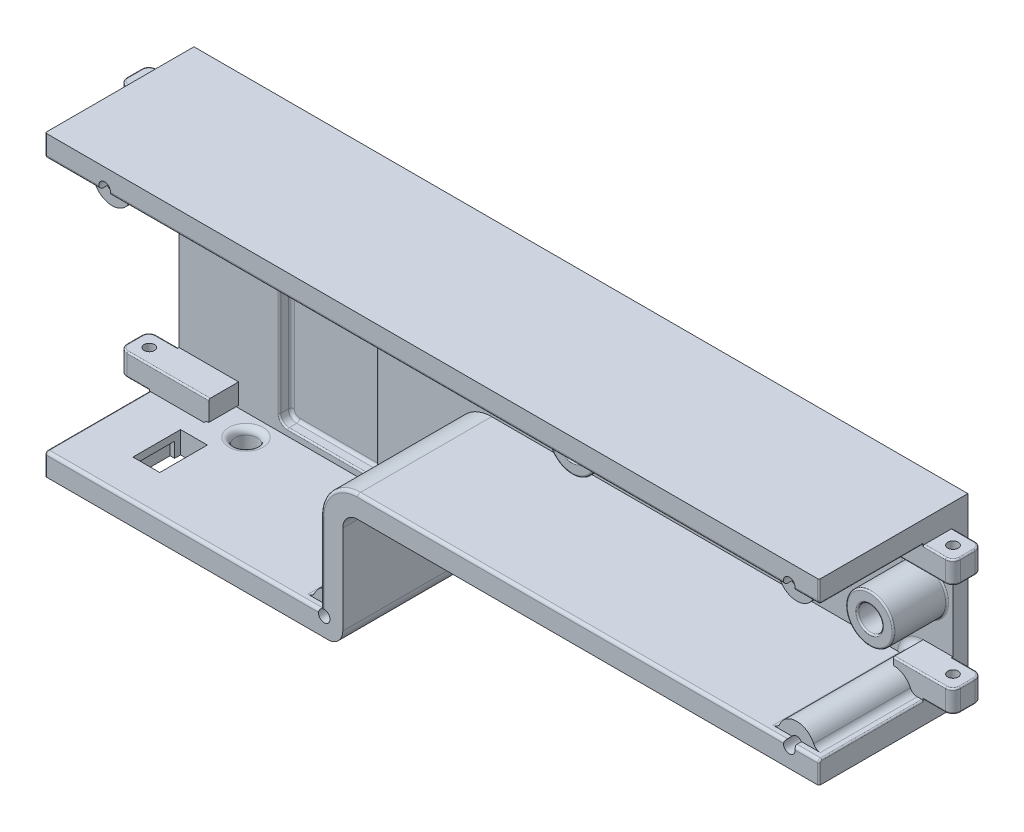
from build123d import *

# Parameters (mm, degrees)
SKETCH1_W             = 840
SKETCH1_H             = 140
SKETCH1_R             = 4.15
BOSS_EXTRUDE1_DEPTH   = 5
SKETCH2_R             = 8
SKETCH2_R_2           = 4.15
BOSS_EXTRUDE3_DEPTH   = 18
LPATTERN1_COUNT       = 7
LPATTERN1_PITCH       = 100
SKETCH4_W             = 45.610881299
SKETCH4_H             = 87.937650726
BOSS_EXTRUDE4_DEPTH   = 1
SKETCH5_W             = 840
SKETCH5_H             = 5
CUT_EXTRUDE1_DEPTH    = 40
SKETCH6_W             = 720
SKETCH6_H             = 40
CUT_EXTRUDE2_DEPTH    = 427.173673518
FILLET1_R             = 5
FILLET2_R             = 0.5
FILLET3_R             = 1
BOSS_EXTRUDE5_DEPTH   = 45
FILLET4_R             = 1
SKETCH10_W            = 7.375
SKETCH10_H            = 85.25
CUT_EXTRUDE3_DEPTH    = 45
FILLET5_R             = 1
SKETCH11_R            = 4.15
BOSS_EXTRUDE6_DEPTH   = 5
CUT_EXTRUDE4_DEPTH    = 20
SKETCH13_W            = 12
SKETCH13_H            = 12
CUT_EXTRUDE5_DEPTH    = 5
CUT_EXTRUDE6_REACH    = 1266.951
SKETCH14_W            = 9
SKETCH14_H            = 16
SKETCH20_R            = 1.95
CUT_EXTRUDE8_DEPTH    = 26
BOSS_EXTRUDE8_REACH   = 1264.837
SKETCH22_R            = 6.25
SKETCH22_R_2          = 1.95
BOSS_EXTRUDE9_DEPTH   = 19
FILLET6_R             = 2.5
SKETCH24_W            = 124.039540835
SKETCH24_H            = 143.716496108
CUT_EXTRUDE9_DEPTH    = 567.568618977
BOSS_EXTRUDE10_DEPTH  = 10
SKETCH26_W            = 9.875
SKETCH26_H            = 7.5
BOSS_EXTRUDE11_DEPTH  = 10
FILLET7_R             = 2.5
FILLET8_R             = 0.5
FILLET7_OF_MIRROR2_R  = 2.5
FILLET8_OF_MIRROR2_R  = 0.5
SKETCH27_R            = 1.75
CUT_EXTRUDE10_DEPTH   = 55
FILLET9_R             = 0.5
CUT_EXTRUDE11_REACH   = 720.749
SKETCH28_R            = 3.75
FILLET10_R            = 2
BOSS_EXTRUDE12_DEPTH  = 10
SKETCH30_W            = 9.875
SKETCH30_H            = 7.5
BOSS_EXTRUDE13_DEPTH  = 10
FILLET11_R            = 2.5
FILLET12_R            = 0.5
FILLET11_OF_MIRROR3_R = 2.5
FILLET12_OF_MIRROR3_R = 0.5
SKETCH31_R            = 1.75
CUT_EXTRUDE12_DEPTH   = 718.743861104


with BuildPart() as part:
    # Sketch1 → Boss-Extrude1 (new body)
    with BuildSketch(Plane.XY):
        Rectangle(SKETCH1_W, SKETCH1_H)
        with Locations((-350, 0)):
            Circle(SKETCH1_R, mode=Mode.SUBTRACT)
        with Locations((-250, 0)):
            Circle(SKETCH1_R, mode=Mode.SUBTRACT)
        with Locations((-150, 0)):
            Circle(SKETCH1_R, mode=Mode.SUBTRACT)
        with Locations((-50, 0)):
            Circle(SKETCH1_R, mode=Mode.SUBTRACT)
        with Locations((50, 0)):
            Circle(SKETCH1_R, mode=Mode.SUBTRACT)
        with Locations((150, 0)):
            Circle(SKETCH1_R, mode=Mode.SUBTRACT)
        with Locations((250, 0)):
            Circle(SKETCH1_R, mode=Mode.SUBTRACT)
        with BuildLine():
            Line((333.7, -57.5), (333.7, 17.5))
            ThreePointArc((333.7, 17.5), (334.520101013, 19.479898987), (336.5, 20.3))
            Line((336.5, 20.3), (363.5, 20.3))
            ThreePointArc((363.5, 20.3), (365.479898987, 19.479898987), (366.3, 17.5))
            Line((366.3, 17.5), (366.3, -57.5))
            ThreePointArc((366.3, -57.5), (365.479898987, -59.479898987), (363.5, -60.3))
            Line((363.5, -60.3), (336.5, -60.3))
            ThreePointArc((336.5, -60.3), (334.520101013, -59.479898987), (333.7, -57.5))
        make_face(mode=Mode.SUBTRACT)
    extrude(amount=BOSS_EXTRUDE1_DEPTH)

    # Sketch2 → Boss-Extrude3 (add)
    with BuildSketch(Plane.XY.offset(5)):
        with Locations(Location((-350, 0, 0), (0, 0, 180))):
            Circle(SKETCH2_R)
        with Locations((-350, 0)):
            Circle(SKETCH2_R_2, mode=Mode.SUBTRACT)
    boss_extrude3 = extrude(amount=BOSS_EXTRUDE3_DEPTH)

    # LPattern1: Boss-Extrude3 ×7
    with Locations(*[(i * LPATTERN1_PITCH, 0, 0) for i in range(1, LPATTERN1_COUNT)]):
        add(boss_extrude3)

    # Sketch4 → Boss-Extrude4 (add)
    with BuildSketch(Plane(origin=(0, 0, 0), x_dir=(-1, 0, 0), z_dir=(0, 0, -1))):
        with Locations((-349.932526386, -19.852361379)):
            Rectangle(SKETCH4_W, SKETCH4_H)
    extrude(amount=-BOSS_EXTRUDE4_DEPTH)

    # Sketch5 → Cut-Extrude1 (cut)
    with BuildSketch(Plane(origin=(0, 70, 0), x_dir=(1, 0, 0), z_dir=(0, 1, 0))):
        with Locations((0, -2.5)):
            Rectangle(SKETCH5_W, SKETCH5_H)
    extrude(amount=-CUT_EXTRUDE1_DEPTH, mode=Mode.SUBTRACT)

    # Sketch6 → Cut-Extrude2 (cut, through all)
    with BuildSketch(Plane.XY.offset(5)):
        with Locations((-60, -50)):
            Rectangle(SKETCH6_W, SKETCH6_H)
    extrude(amount=-CUT_EXTRUDE2_DEPTH, mode=Mode.SUBTRACT)

    # Fillet1
    fillet1_edges = [part.edges().sort_by_distance(p)[0] for p in [
        (-420, 30, 2.5),
        (-420, -30, 2.5),
        (300, -30, 2.5),
        (300, -70, 2.5),
    ]]
    fillet(fillet1_edges, radius=FILLET1_R)

    # Fillet2
    fillet2_edges = [part.edges().sort_by_distance(p)[0] for p in [
        (334.520101013, -59.479898987, 5),
        (350, -60.3, 5),
        (365.479898987, -59.479898987, 5),
        (366.3, -20, 5),
        (365.479898987, 19.479898987, 5),
        (350, 20.3, 5),
        (334.520101013, 19.479898987, 5),
        (333.7, -20, 5),
        (-342, 0, 5),
        (-342, 0, 23),
        (-354.15, 0, 23),
        (258, 0, 5),
        (158, 0, 5),
        (58, 0, 5),
        (-42, 0, 5),
        (-142, 0, 5),
        (-242, 0, 5),
        (-242, 0, 23),
        (-254.15, 0, 23),
        (-142, 0, 23),
        (-154.15, 0, 23),
        (-42, 0, 23),
        (-54.15, 0, 23),
        (58, 0, 23),
        (45.85, 0, 23),
        (158, 0, 23),
        (145.85, 0, 23),
        (258, 0, 23),
        (245.85, 0, 23),
    ]]
    fillet(fillet2_edges, radius=FILLET2_R)

    # Fillet3
    fillet3_edges = [part.edges().sort_by_distance(p)[0] for p in [
        (333.7, -20, 1),
        (350, -60.3, 1),
        (334.520101013, -59.479898987, 1),
        (334.520101013, 19.479898987, 1),
        (350, 20.3, 1),
        (365.479898987, 19.479898987, 1),
        (366.3, -20, 1),
        (365.479898987, -59.479898987, 1),
    ]]
    fillet(fillet3_edges, radius=FILLET3_R)

    # Sketch8 → Boss-Extrude5 (add)
    with BuildSketch(Plane.XY.offset(5)):
        with BuildLine():
            Line((300, -35), (300, -65))
            ThreePointArc((300, -65), (301.464466094, -68.535533906), (305, -70))
            Line((305, -70), (420, -70))
            Line((420, -70), (420, 30))
            Line((420, 30), (-415, 30))
            ThreePointArc((-415, 30), (-418.535533906, 28.535533906), (-420, 25))
            Line((-420, 25), (-420, -25))
            ThreePointArc((-420, -25), (-418.535533906, -28.535533906), (-415, -30))
            Line((-415, -30), (295, -30))
            ThreePointArc((295, -30), (298.535533906, -31.464466094), (300, -35))
        make_face()
        with BuildLine():
            Line((412.625, -62.625), (412.625, 22.625))
            Line((412.625, 22.625), (-412.625, 22.625))
            Line((-412.625, 22.625), (-412.625, -22.625))
            Line((-412.625, -22.625), (295, -22.625))
            ThreePointArc((295, -22.625), (303.750446417, -26.249553583), (307.375, -35))
            Line((307.375, -35), (307.375, -62.625))
            Line((307.375, -62.625), (412.625, -62.625))
        make_face(mode=Mode.SUBTRACT)
    extrude(amount=BOSS_EXTRUDE5_DEPTH)

    # Fillet4
    fillet4_edges = [part.edges().sort_by_distance(p)[0] for p in [
        (-58.8125, -22.625, 50),
        (303.750446417, -26.249553583, 50),
        (307.375, -48.8125, 50),
    ]]
    fillet(fillet4_edges, radius=FILLET4_R)

    # Sketch10 → Cut-Extrude3 (cut)
    with BuildSketch(Plane.XY.offset(50)):
        with Locations((416.3125, -20)):
            Rectangle(SKETCH10_W, SKETCH10_H)
    extrude(amount=-CUT_EXTRUDE3_DEPTH, mode=Mode.SUBTRACT)

    # Fillet5
    fillet5_edges = [part.edges().sort_by_distance(p)[0] for p in [
        (-412.625, -0.5, 50),
        (3.6875, 22.625, 50),
        (363.1875, -62.625, 50),
    ]]
    fillet(fillet5_edges, radius=FILLET5_R)

    # Sketch11 → Boss-Extrude6 (add)
    with BuildSketch(Plane(origin=(0, 0, 0), x_dir=(-1, 0, 0), z_dir=(0, 0, -1))):
        with Locations((-250, 0)):
            Circle(SKETCH11_R)
        with Locations((-150, 0)):
            Circle(SKETCH11_R)
        with Locations((-50, 0)):
            Circle(SKETCH11_R)
        with Locations((50, 0)):
            Circle(SKETCH11_R)
        with Locations((150, 0)):
            Circle(SKETCH11_R)
        with Locations((250, 0)):
            Circle(SKETCH11_R)
        with Locations((350, 0)):
            Circle(SKETCH11_R)
    extrude(amount=-BOSS_EXTRUDE6_DEPTH)


with BuildPart() as body_2:
    # Mirror1: mirrored copy
    add(part.part.mirror(Plane(origin=(420, -70, 5), x_dir=(0, 0, 1), z_dir=(-1, 0, 0))))

    # Sketch12 → Cut-Extrude4 (cut)
    with BuildSketch(Plane.ZY.offset(-420)):
        with BuildLine():
            Line((50, 23.625), (50, 30))
            Line((50, 30), (0, 30))
            Line((0, 30), (0, -70))
            Line((0, -70), (50, -70))
            Line((50, -70), (50, -63.625))
            ThreePointArc((50, -63.625), (49.707106781, -62.917893219), (49, -62.625))
            Line((49, -62.625), (5, -62.625))
            Line((5, -62.625), (5, 22.625))
            Line((5, 22.625), (49, 22.625))
            ThreePointArc((49, 22.625), (49.707106781, 22.917893219), (50, 23.625))
        make_face()
    extrude(amount=-CUT_EXTRUDE4_DEPTH, mode=Mode.SUBTRACT)

    # Sketch13 → Cut-Extrude5 (cut)
    with BuildSketch(Plane.XZ.offset(70)):
        with Locations((461, 29)):
            Rectangle(SKETCH13_W, SKETCH13_H)
    extrude(amount=-CUT_EXTRUDE5_DEPTH, mode=Mode.SUBTRACT)

    # Sketch14 → Cut-Extrude6 (cut, up to next)
    with BuildSketch(Plane.XZ.offset(70), mode=Mode.PRIVATE) as cut_extrude6_sk1:
        with Locations((461, 29)):
            Rectangle(SKETCH14_W, SKETCH14_H)
    cut_extrude6_tool1 = extrude(cut_extrude6_sk1.sketch, amount=-CUT_EXTRUDE6_REACH, mode=Mode.PRIVATE) & body_2.part
    add(cut_extrude6_tool1.solids().sort_by_distance((461, -70, 29))[0], mode=Mode.SUBTRACT)

    # Sketch20 → Cut-Extrude8 (cut)
    with BuildSketch(Plane.XY.offset(50)):
        with Locations((790, 23.75)):
            Circle(SKETCH20_R)
        with Locations((790, -23.75)):
            Circle(SKETCH20_R)
        with Locations((460, 23.75)):
            Circle(SKETCH20_R)
        with Locations((533.75, -63.75)):
            Circle(SKETCH20_R)
        with Locations((690, 23.75)):
            Circle(SKETCH20_R)
        with Locations((890, -23.75)):
            Circle(SKETCH20_R)
        with Locations((990, 23.75)):
            Circle(SKETCH20_R)
        with Locations((690, -23.75)):
            Circle(SKETCH20_R)
        with Locations((890, 23.75)):
            Circle(SKETCH20_R)
        with Locations((990, -23.75)):
            Circle(SKETCH20_R)
        with Locations((1190, 23.75)):
            Circle(SKETCH20_R)
        with Locations((1253.75, -23.75)):
            Circle(SKETCH20_R)
    extrude(amount=-CUT_EXTRUDE8_DEPTH, mode=Mode.SUBTRACT)

    # Sketch22 → Boss-Extrude8 (add, up to next)
    with BuildSketch(Plane.XY.offset(47.5), mode=Mode.PRIVATE) as boss_extrude8_sk1:
        with Locations((460, 23.75)):
            Circle(SKETCH22_R)
        with Locations(Location((460, 23.75, 0), (0, 0, 324.765582015))):
            Circle(SKETCH22_R_2, mode=Mode.SUBTRACT)
    boss_extrude8_tool1 = extrude(boss_extrude8_sk1.sketch, amount=-BOSS_EXTRUDE8_REACH, mode=Mode.PRIVATE) - body_2.part
    # Sketch22 → Boss-Extrude8 (add, up to next)
    with BuildSketch(Plane.XY.offset(47.5), mode=Mode.PRIVATE) as boss_extrude8_sk2:
        with Locations((690, 23.75)):
            Circle(SKETCH22_R)
        with Locations(Location((690, 23.75, 0), (0, 0, 324.765582015))):
            Circle(SKETCH22_R_2, mode=Mode.SUBTRACT)
    boss_extrude8_tool2 = extrude(boss_extrude8_sk2.sketch, amount=-BOSS_EXTRUDE8_REACH, mode=Mode.PRIVATE) - body_2.part
    # Sketch22 → Boss-Extrude8 (add, up to next)
    with BuildSketch(Plane.XY.offset(47.5), mode=Mode.PRIVATE) as boss_extrude8_sk3:
        with Locations((790, 23.75)):
            Circle(SKETCH22_R)
        with Locations(Location((790, 23.75, 0), (0, 0, 324.765582015))):
            Circle(SKETCH22_R_2, mode=Mode.SUBTRACT)
    boss_extrude8_tool3 = extrude(boss_extrude8_sk3.sketch, amount=-BOSS_EXTRUDE8_REACH, mode=Mode.PRIVATE) - body_2.part
    # Sketch22 → Boss-Extrude8 (add, up to next)
    with BuildSketch(Plane.XY.offset(47.5), mode=Mode.PRIVATE) as boss_extrude8_sk4:
        with Locations((890, 23.75)):
            Circle(SKETCH22_R)
        with Locations(Location((890, 23.75, 0), (0, 0, 324.765582015))):
            Circle(SKETCH22_R_2, mode=Mode.SUBTRACT)
    boss_extrude8_tool4 = extrude(boss_extrude8_sk4.sketch, amount=-BOSS_EXTRUDE8_REACH, mode=Mode.PRIVATE) - body_2.part
    # Sketch22 → Boss-Extrude8 (add, up to next)
    with BuildSketch(Plane.XY.offset(47.5), mode=Mode.PRIVATE) as boss_extrude8_sk5:
        with Locations((990, 23.75)):
            Circle(SKETCH22_R)
        with Locations(Location((990, 23.75, 0), (0, 0, 324.765582015))):
            Circle(SKETCH22_R_2, mode=Mode.SUBTRACT)
    boss_extrude8_tool5 = extrude(boss_extrude8_sk5.sketch, amount=-BOSS_EXTRUDE8_REACH, mode=Mode.PRIVATE) - body_2.part
    # Sketch22 → Boss-Extrude8 (add, up to next)
    with BuildSketch(Plane.XY.offset(47.5), mode=Mode.PRIVATE) as boss_extrude8_sk6:
        with Locations((1190, 23.75)):
            Circle(SKETCH22_R)
        with Locations(Location((1190, 23.75, 0), (0, 0, 324.765582015))):
            Circle(SKETCH22_R_2, mode=Mode.SUBTRACT)
    boss_extrude8_tool6 = extrude(boss_extrude8_sk6.sketch, amount=-BOSS_EXTRUDE8_REACH, mode=Mode.PRIVATE) - body_2.part
    # Sketch22 → Boss-Extrude8 (add, up to next)
    with BuildSketch(Plane.XY.offset(47.5), mode=Mode.PRIVATE) as boss_extrude8_sk7:
        with Locations((1253.75, -23.75)):
            Circle(SKETCH22_R)
        with Locations(Location((1253.75, -23.75, 0), (0, 0, 125.234417985))):
            Circle(SKETCH22_R_2, mode=Mode.SUBTRACT)
    boss_extrude8_tool7 = extrude(boss_extrude8_sk7.sketch, amount=-BOSS_EXTRUDE8_REACH, mode=Mode.PRIVATE) - body_2.part
    # Sketch22 → Boss-Extrude8 (add, up to next)
    with BuildSketch(Plane.XY.offset(47.5), mode=Mode.PRIVATE) as boss_extrude8_sk8:
        with Locations((990, -23.75)):
            Circle(SKETCH22_R)
        with Locations(Location((990, -23.75, 0), (0, 0, 35.234417985))):
            Circle(SKETCH22_R_2, mode=Mode.SUBTRACT)
    boss_extrude8_tool8 = extrude(boss_extrude8_sk8.sketch, amount=-BOSS_EXTRUDE8_REACH, mode=Mode.PRIVATE) - body_2.part
    # Sketch22 → Boss-Extrude8 (add, up to next)
    with BuildSketch(Plane.XY.offset(47.5), mode=Mode.PRIVATE) as boss_extrude8_sk9:
        with Locations((890, -23.75)):
            Circle(SKETCH22_R)
        with Locations(Location((890, -23.75, 0), (0, 0, 35.234417985))):
            Circle(SKETCH22_R_2, mode=Mode.SUBTRACT)
    boss_extrude8_tool9 = extrude(boss_extrude8_sk9.sketch, amount=-BOSS_EXTRUDE8_REACH, mode=Mode.PRIVATE) - body_2.part
    # Sketch22 → Boss-Extrude8 (add, up to next)
    with BuildSketch(Plane.XY.offset(47.5), mode=Mode.PRIVATE) as boss_extrude8_sk10:
        with Locations((790, -23.75)):
            Circle(SKETCH22_R)
        with Locations(Location((790, -23.75, 0), (0, 0, 35.234417985))):
            Circle(SKETCH22_R_2, mode=Mode.SUBTRACT)
    boss_extrude8_tool10 = extrude(boss_extrude8_sk10.sketch, amount=-BOSS_EXTRUDE8_REACH, mode=Mode.PRIVATE) - body_2.part
    # Sketch22 → Boss-Extrude8 (add, up to next)
    with BuildSketch(Plane.XY.offset(47.5), mode=Mode.PRIVATE) as boss_extrude8_sk11:
        with Locations((690, -23.75)):
            Circle(SKETCH22_R)
        with Locations(Location((690, -23.75, 0), (0, 0, 35.234417985))):
            Circle(SKETCH22_R_2, mode=Mode.SUBTRACT)
    boss_extrude8_tool11 = extrude(boss_extrude8_sk11.sketch, amount=-BOSS_EXTRUDE8_REACH, mode=Mode.PRIVATE) - body_2.part
    # Sketch22 → Boss-Extrude8 (add, up to next)
    with BuildSketch(Plane.XY.offset(47.5), mode=Mode.PRIVATE) as boss_extrude8_sk12:
        with Locations((533.75, -63.75)):
            Circle(SKETCH22_R)
        with Locations(Location((533.75, -63.75, 0), (0, 0, 125.234417985))):
            Circle(SKETCH22_R_2, mode=Mode.SUBTRACT)
    boss_extrude8_tool12 = extrude(boss_extrude8_sk12.sketch, amount=-BOSS_EXTRUDE8_REACH, mode=Mode.PRIVATE) - body_2.part
    add(boss_extrude8_tool1.solids().sort_by_distance((453.926777, 23.75, 47.5))[0])
    add(boss_extrude8_tool2.solids().sort_by_distance((683.926777, 23.75, 47.5))[0])
    add(boss_extrude8_tool3.solids().sort_by_distance((783.926777, 23.75, 47.5))[0])
    add(boss_extrude8_tool4.solids().sort_by_distance((883.926777, 23.75, 47.5))[0])
    add(boss_extrude8_tool5.solids().sort_by_distance((983.926777, 23.75, 47.5))[0])
    add(boss_extrude8_tool6.solids().sort_by_distance((1183.926777, 23.75, 47.5))[0])
    add(boss_extrude8_tool7.solids().sort_by_distance((1247.676777, -23.75, 47.5))[0])
    add(boss_extrude8_tool8.solids().sort_by_distance((983.926777, -23.75, 47.5))[0])
    add(boss_extrude8_tool9.solids().sort_by_distance((883.926777, -23.75, 47.5))[0])
    add(boss_extrude8_tool10.solids().sort_by_distance((783.926777, -23.75, 47.5))[0])
    add(boss_extrude8_tool11.solids().sort_by_distance((683.926777, -23.75, 47.5))[0])
    add(boss_extrude8_tool12.solids().sort_by_distance((527.676777, -63.75, 47.5))[0])

    # Sketch23 → Boss-Extrude9 (add)
    with BuildSketch(Plane.XY.offset(5)):
        with BuildLine():
            Line((461.592757044, 22.625), (458.407242956, 22.625))
            ThreePointArc((458.407242956, 22.625), (460, 21.8), (461.592757044, 22.625))
        make_face()
        with BuildLine():
            Line((691.592757044, 22.625), (688.407242956, 22.625))
            ThreePointArc((688.407242956, 22.625), (690, 21.8), (691.592757044, 22.625))
        make_face()
        with BuildLine():
            Line((791.592757044, 22.625), (788.407242956, 22.625))
            ThreePointArc((788.407242956, 22.625), (790, 21.8), (791.592757044, 22.625))
        make_face()
        with BuildLine():
            Line((891.592757044, 22.625), (888.407242956, 22.625))
            ThreePointArc((888.407242956, 22.625), (890, 21.8), (891.592757044, 22.625))
        make_face()
        with BuildLine():
            Line((991.592757044, 22.625), (988.407242956, 22.625))
            ThreePointArc((988.407242956, 22.625), (990, 21.8), (991.592757044, 22.625))
        make_face()
        with BuildLine():
            Line((1191.592757044, 22.625), (1188.407242956, 22.625))
            ThreePointArc((1188.407242956, 22.625), (1190, 21.8), (1191.592757044, 22.625))
        make_face()
        with BuildLine():
            Line((1252.157242956, -22.625), (1252.625, -22.625))
            Line((1252.625, -22.625), (1252.625, -22.157242956))
            ThreePointArc((1252.625, -22.157242956), (1252.371141777, -22.371141777), (1252.157242956, -22.625))
        make_face()
        with BuildLine():
            Line((988.407242956, -22.625), (991.592757044, -22.625))
            ThreePointArc((991.592757044, -22.625), (990, -21.8), (988.407242956, -22.625))
        make_face()
        with BuildLine():
            Line((888.407242956, -22.625), (891.592757044, -22.625))
            ThreePointArc((891.592757044, -22.625), (890, -21.8), (888.407242956, -22.625))
        make_face()
        with BuildLine():
            Line((788.407242956, -22.625), (791.592757044, -22.625))
            ThreePointArc((791.592757044, -22.625), (790, -21.8), (788.407242956, -22.625))
        make_face()
        with BuildLine():
            Line((688.407242956, -22.625), (691.592757044, -22.625))
            ThreePointArc((691.592757044, -22.625), (690, -21.8), (688.407242956, -22.625))
        make_face()
        with BuildLine():
            Line((532.157242956, -62.625), (532.625, -62.625))
            Line((532.625, -62.625), (532.625, -62.157242956))
            ThreePointArc((532.625, -62.157242956), (532.371141777, -62.371141777), (532.157242956, -62.625))
        make_face()
    extrude(amount=BOSS_EXTRUDE9_DEPTH)

    # Fillet6
    fillet6_edges = [body_2.edges().sort_by_distance(p)[0] for p in [
        (890, 17.5, 5),
        (990, 17.5, 5),
        (1190, 17.5, 5),
        (1252.625, -17.602083686, 26.25),
        (1249.330582618, -19.330582618, 5),
        (990, -17.5, 5),
        (890, -17.5, 5),
        (532.625, -57.602083686, 26.25),
        (896.147916314, -22.625, 26.25),
        (883.852083686, -22.625, 26.25),
        (996.147916314, -22.625, 26.25),
        (983.852083686, -22.625, 26.25),
        (1247.602083686, -22.625, 26.25),
        (796.147916314, -22.625, 26.25),
        (783.852083686, -22.625, 26.25),
        (696.147916314, -22.625, 26.25),
        (683.852083686, -22.625, 26.25),
        (1183.852083686, 22.625, 26.25),
        (1196.147916314, 22.625, 26.25),
        (983.852083686, 22.625, 26.25),
        (996.147916314, 22.625, 26.25),
        (883.852083686, 22.625, 26.25),
        (896.147916314, 22.625, 26.25),
        (783.852083686, 22.625, 26.25),
        (796.147916314, 22.625, 26.25),
        (683.852083686, 22.625, 26.25),
        (696.147916314, 22.625, 26.25),
        (453.852083686, 22.625, 26.25),
        (466.147916314, 22.625, 26.25),
        (460, 17.5, 5),
        (529.330582618, -59.330582618, 5),
        (527.602083686, -62.625, 26.25),
        (690, -17.5, 5),
        (790, -17.5, 5),
        (690, 17.5, 5),
        (790, 17.5, 5),
    ]]
    fillet(fillet6_edges, radius=FILLET6_R)

    # Sketch24 → Cut-Extrude9 (cut, through all)
    with BuildSketch(Plane.ZY.offset(-700)):
        with Locations((24.003698467, -16.88655771)):
            Rectangle(SKETCH24_W, SKETCH24_H)
    extrude(amount=-CUT_EXTRUDE9_DEPTH, mode=Mode.SUBTRACT)

    # Sketch25 → Boss-Extrude10 (add)
    with BuildSketch(Plane.XY.offset(5)):
        with BuildLine():
            Line((690, 15), (700, 15))
            Line((700, 15), (700, 22.625))
            Line((700, 22.625), (691.592757044, 22.625))
            ThreePointArc((691.592757044, 22.625), (690.896869556, 22.018490543), (690, 21.8))
            Line((690, 21.8), (690, 15))
        make_face()
    boss_extrude10 = extrude(amount=BOSS_EXTRUDE10_DEPTH)

    # Sketch26 → Boss-Extrude11 (add)
    with BuildSketch(Plane(origin=(700, 0, 0), x_dir=(0, 0, -1), z_dir=(1, 0, 0))):
        with Locations((-10.0625, 18.75)):
            Rectangle(SKETCH26_W, SKETCH26_H)
    boss_extrude11 = extrude(amount=BOSS_EXTRUDE11_DEPTH)

    # Fillet7
    fillet7_edges = [body_2.edges().sort_by_distance(p)[0] for p in [
        (710, 18.75, 15),
        (710, 18.75, 5.125),
    ]]
    fillet(fillet7_edges, radius=FILLET7_R)

    # Fillet8
    fillet8_edges = [body_2.edges().sort_by_distance(p)[0] for p in [
        (698.75, 15, 15),
        (710, 15, 10.0625),
        (710, 22.5, 10.0625),
        (703.75, 22.5, 15),
        (703.75, 22.5, 5.125),
        (709.267766953, 22.5, 14.267766953),
        (709.267766953, 22.5, 5.857233047),
        (703.75, 15, 5.125),
        (709.267766953, 15, 14.267766953),
        (709.267766953, 15, 5.857233047),
    ]]
    fillet(fillet8_edges, radius=FILLET8_R)

    # Mirror2: Boss-Extrude10, Boss-Extrude11 across plane
    add(boss_extrude10.mirror(Plane.ZX))
    add(boss_extrude11.mirror(Plane.ZX))

    # Fillet7 of Mirror2
    fillet7_of_mirror2_edges = [body_2.edges().sort_by_distance(p)[0] for p in [
        (710, -18.75, 15),
        (710, -18.75, 5.125),
    ]]
    fillet(fillet7_of_mirror2_edges, radius=FILLET7_OF_MIRROR2_R)

    # Fillet8 of Mirror2
    fillet8_of_mirror2_edges = [body_2.edges().sort_by_distance(p)[0] for p in [
        (698.75, -15, 15),
        (710, -15, 10.0625),
        (710, -22.5, 10.0625),
        (703.75, -22.5, 15),
        (703.75, -22.5, 5.125),
        (709.267766953, -22.5, 14.267766953),
        (709.267766953, -22.5, 5.857233047),
        (703.75, -15, 5.125),
        (709.267766953, -15, 14.267766953),
        (709.267766953, -15, 5.857233047),
    ]]
    fillet(fillet8_of_mirror2_edges, radius=FILLET8_OF_MIRROR2_R)

    # Sketch27 → Cut-Extrude10 (cut, symmetric)
    with BuildSketch(Plane(origin=(0, 22.5, 0), x_dir=(1, 0, 0), z_dir=(0, 1, 0))):
        with Locations(Location((705, -10, 0), (0, 0, 180))):
            Circle(SKETCH27_R)
    extrude(amount=CUT_EXTRUDE10_DEPTH, both=True, mode=Mode.SUBTRACT)

    # Fillet9
    fillet9_edges = [body_2.edges().sort_by_distance(p)[0] for p in [
        (700, 26.8125, 50),
        (700, 22.917893219, 49.707106781),
        (700, 22.625, 32),
        (700, -22.917893219, 49.707106781),
        (700, -26.8125, 50),
        (700, -22.625, 32),
    ]]
    fillet(fillet9_edges, radius=FILLET9_R)

    # Sketch28 → Cut-Extrude11 (cut, up to next)
    with BuildSketch(Plane.XZ.offset(70), mode=Mode.PRIVATE) as cut_extrude11_sk1:
        with Locations(Location((469.744143867, 12.249875986, 0), (0, 0, 270))):
            Circle(SKETCH28_R)
    cut_extrude11_tool1 = extrude(cut_extrude11_sk1.sketch, amount=-CUT_EXTRUDE11_REACH, mode=Mode.PRIVATE) & body_2.part
    add(cut_extrude11_tool1.solids().sort_by_distance((469.744144, -70, 12.249876))[0], mode=Mode.SUBTRACT)

    # Fillet10
    fillet10_edges = [body_2.edges().sort_by_distance(p)[0] for p in [
        (469.744143867, -62.625, 15.999875986),
    ]]
    fillet(fillet10_edges, radius=FILLET10_R)

    # Sketch29 → Boss-Extrude12 (add)
    with BuildSketch(Plane.XY.offset(5)):
        with BuildLine():
            Line((460, 21.8), (460, 15))
            Line((460, 15), (440, 15))
            Line((440, 15), (440, 22.625))
            Line((440, 22.625), (458.407242956, 22.625))
            ThreePointArc((458.407242956, 22.625), (459.103130444, 22.018490543), (460, 21.8))
        make_face()
    boss_extrude12 = extrude(amount=BOSS_EXTRUDE12_DEPTH)

    # Sketch30 → Boss-Extrude13 (add)
    with BuildSketch(Plane.ZY.offset(-440)):
        with Locations((10.0625, 18.75)):
            Rectangle(SKETCH30_W, SKETCH30_H)
    boss_extrude13 = extrude(amount=BOSS_EXTRUDE13_DEPTH)

    # Fillet11
    fillet11_edges = [body_2.edges().sort_by_distance(p)[0] for p in [
        (430, 18.75, 15),
        (430, 18.75, 5.125),
    ]]
    fillet(fillet11_edges, radius=FILLET11_R)

    # Fillet12
    fillet12_edges = [body_2.edges().sort_by_distance(p)[0] for p in [
        (440, 22.625, 32),
        (430, 22.5, 10.0625),
        (430, 15, 10.0625),
        (446.25, 15, 15),
        (436.25, 15, 5.125),
        (430.732233047, 15, 14.267766953),
        (430.732233047, 15, 5.857233047),
        (436.25, 22.5, 5.125),
        (436.25, 22.5, 15),
        (430.732233047, 22.5, 14.267766953),
        (430.732233047, 22.5, 5.857233047),
        (440, 22.917893219, 49.707106781),
        (440, 26.8125, 50),
    ]]
    fillet(fillet12_edges, radius=FILLET12_R)

    # Mirror3: Boss-Extrude12, Boss-Extrude13 across plane
    add(boss_extrude12.mirror(Plane.ZX.offset(-20)))
    add(boss_extrude13.mirror(Plane.ZX.offset(-20)))

    # Fillet11 of Mirror3
    fillet11_of_mirror3_edges = [body_2.edges().sort_by_distance(p)[0] for p in [
        (430, -58.75, 15),
        (430, -58.75, 5.125),
    ]]
    fillet(fillet11_of_mirror3_edges, radius=FILLET11_OF_MIRROR3_R)

    # Fillet12 of Mirror3
    fillet12_of_mirror3_edges = [body_2.edges().sort_by_distance(p)[0] for p in [
        (440, -62.625, 32),
        (430, -62.5, 10.0625),
        (430, -55, 10.0625),
        (446.25, -55, 15),
        (436.25, -55, 5.125),
        (430.732233047, -55, 14.267766953),
        (430.732233047, -55, 5.857233047),
        (436.25, -62.5, 5.125),
        (436.25, -62.5, 15),
        (430.732233047, -62.5, 14.267766953),
        (430.732233047, -62.5, 5.857233047),
        (440, -62.917893219, 49.707106781),
        (440, -66.8125, 50),
    ]]
    fillet(fillet12_of_mirror3_edges, radius=FILLET12_OF_MIRROR3_R)

    # Sketch31 → Cut-Extrude12 (cut, through all)
    with BuildSketch(Plane(origin=(0, 22.5, 0), x_dir=(1, 0, 0), z_dir=(0, 1, 0))):
        with Locations(Location((435, -10, 0), (0, 0, 270))):
            Circle(SKETCH31_R)
    extrude(amount=-CUT_EXTRUDE12_DEPTH, mode=Mode.SUBTRACT)


solid = body_2.part
